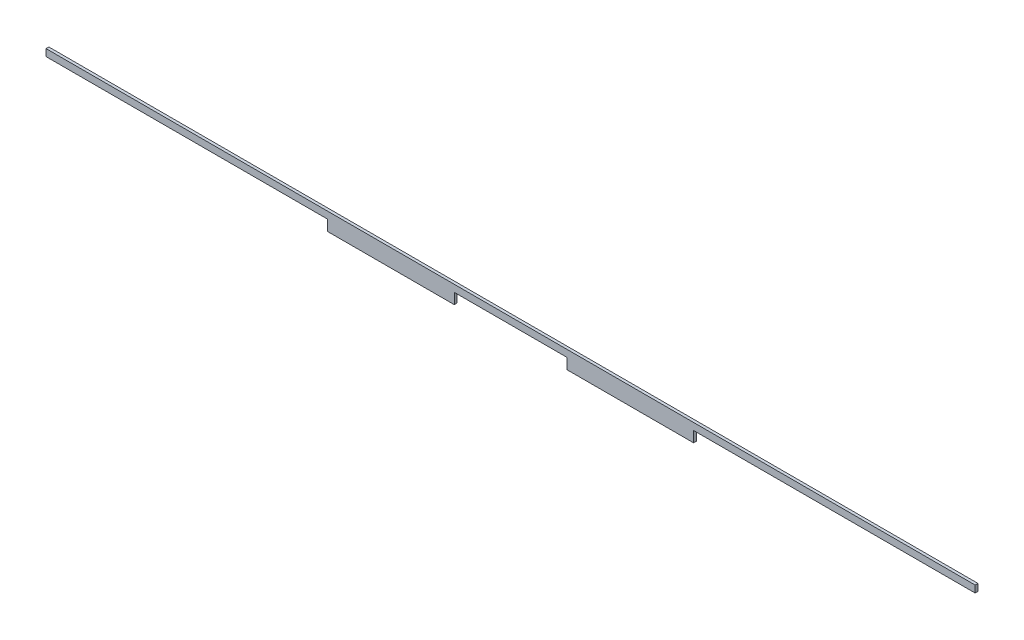
from build123d import *

# Parameters (mm, degrees)
BOSS_EXTRUDE1_DEPTH = 3


with BuildPart() as part:
    # Sketch1 → Boss-Extrude1 (new body)
    with BuildSketch(Plane.XY):
        Polygon((-250.162506049, 15.130245488), (739.837493951, 15.130245488), (739.837493951, 7.715764798), (439.837493951, 7.715764798), (439.837493951, -3.681233155), (304.837493951, -3.681233155), (304.837493951, 7.715764798), (184.837493951, 7.715764798), (184.837493951, -3.681233155), (49.837493951, -3.681233155), (49.837493951, 7.715764798), (-250.162506049, 7.715764798), align=None)
    extrude(amount=BOSS_EXTRUDE1_DEPTH)


solid = part.part
